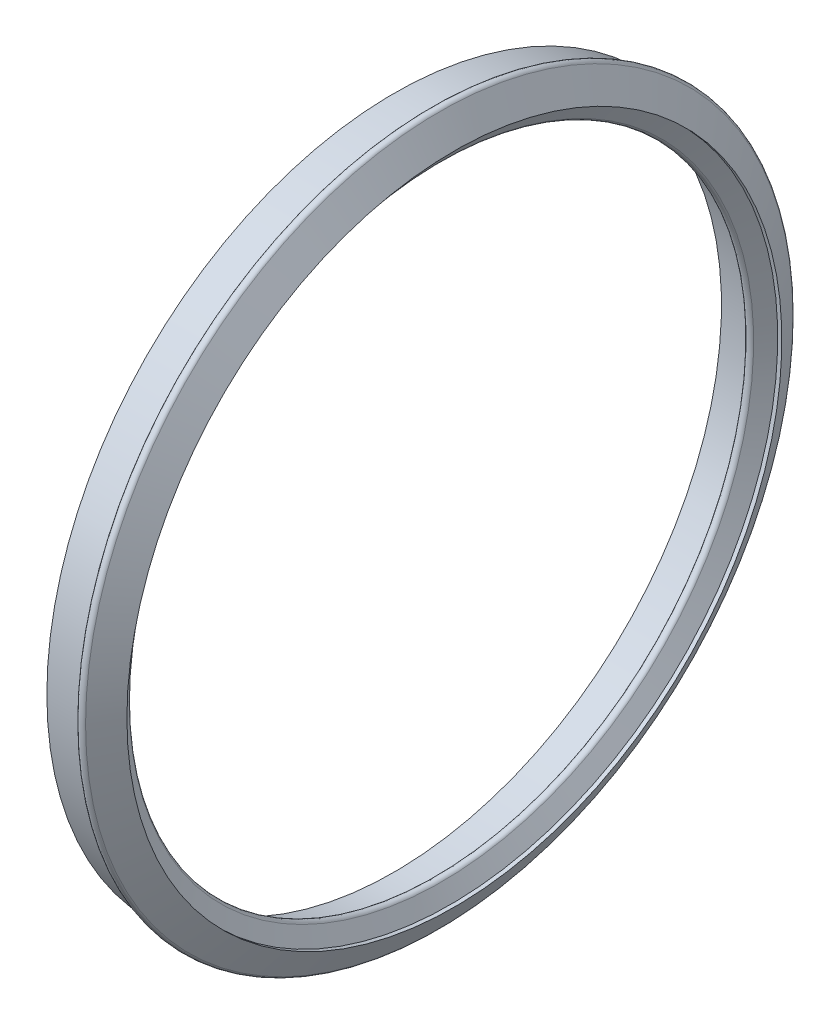
from build123d import *


with BuildPart() as part:
    # Эскиз1 → Повернуть1 (revolve)
    with BuildSketch(Plane.XY):
        with BuildLine():
            Line((0, 20), (1.553589838, 20))
            Line((1.553589838, 20), (1.726794919, 20.3))
            ThreePointArc((1.726794919, 20.3), (1.9, 20.4), (2.073205081, 20.3))
            Line((2.073205081, 20.3), (2.766025404, 19.1))
            Line((2.766025404, 19.1), (2.577350269, 19.1))
            Line((2.577350269, 19.1), (2.173205081, 18.4))
            ThreePointArc((2.173205081, 18.4), (2, 18.3), (1.826794919, 18.4))
            Line((1.826794919, 18.4), (1.422649731, 19.1))
            Line((1.422649731, 19.1), (0, 19.1))
            Line((0, 19.1), (0, 20))
        make_face()
    revolve(axis=Axis((0, 4.1, 0), (1, 0, 0)))


solid = part.part
